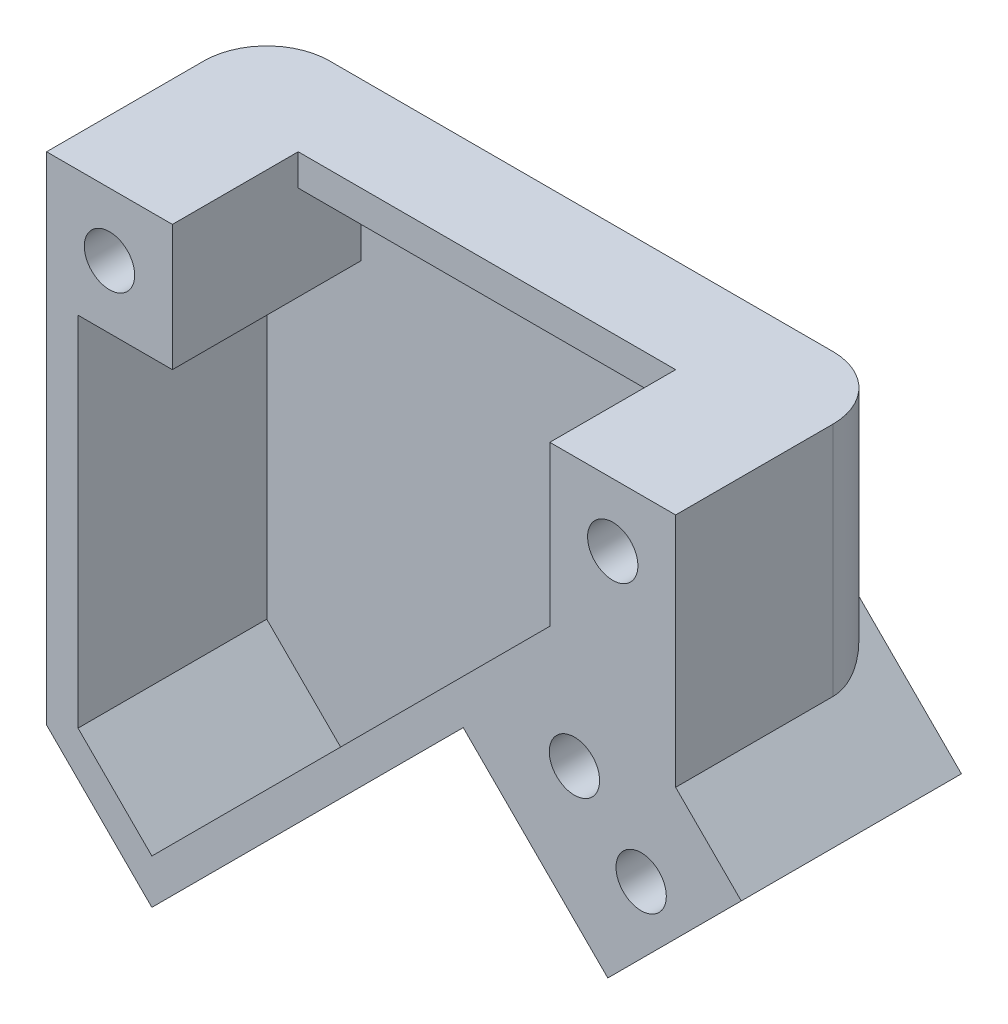
from build123d import *

# Parameters (mm, degrees)
BOSS_EXTRUDE1_DEPTH = 7
BOSS_EXTRUDE2_DEPTH = 1
SKETCH5_R           = 0.799999999
SKETCH5_R_2         = 0.800000001
SCREW_HOLES_DEPTH   = 31.046659105
FILLET1_R           = 2
CUT_EXTRUDE2_START  = 7
SKETCH7_W           = 11.999999998
SKETCH7_H           = 4
CUT_EXTRUDE2_DEPTH  = 4


with BuildPart() as part:
    # Sketch1 → Boss-Extrude1 (new body)
    with BuildSketch(Plane.XY):
        Polygon((0, 0), (19.999999998, 0), (19.999999998, -7.5), (22.085746954, -9.585746956), (17.843106269, -13.828387641), (13.246912191, -9.232193563), (3.347417254, -19.1316885), (0, -15.784271246), align=None)
        Polygon((4, -1), (4, -4), (1, -4), (1, -15.370057685), (3.347417253, -17.717474938), (15.999999998, -5.064892192), (15.999999998, -1), align=None, mode=Mode.SUBTRACT)
    extrude(amount=BOSS_EXTRUDE1_DEPTH)

    # Sketch6 → Boss-Extrude2 (add)
    with BuildSketch(Plane.XY):
        Polygon((0, 0), (19.999999998, 0), (19.999999998, -7.5), (22.085746954, -9.585746956), (17.843106269, -13.828387641), (13.246912191, -9.232193563), (3.347417254, -19.1316885), (0, -15.784271246), align=None)
    extrude(amount=BOSS_EXTRUDE2_DEPTH)

    # Sketch5 → Screw Holes (cut, through all)
    with BuildSketch(Plane.XY):
        with Locations((18.90376644, -10.646407127)):
            Circle(SKETCH5_R)
        with Locations((16.782446096, -8.525086783)):
            Circle(SKETCH5_R)
        with Locations((1.999999999, -2)):
            Circle(SKETCH5_R_2)
        with Locations((17.999999999, -2)):
            Circle(SKETCH5_R_2)
    extrude(amount=SCREW_HOLES_DEPTH, mode=Mode.SUBTRACT)

    # Fillet1
    # the kernel refuses this fillet: 2 mm, written as the material it takes off along each edge
    with BuildSketch(Plane(origin=(19.999999998, 5, 0), x_dir=(-1, 0, 0), z_dir=(0, -1, 0))) as fillet1_piece_1_section:
        with BuildLine():
            CenterArc((FILLET1_R, -FILLET1_R), FILLET1_R, 90, 90)
            Line((0, -FILLET1_R), (0, 0))
            Line((0, 0), (FILLET1_R, 0))
        make_face()
    fillet1_piece_1 = extrude(amount=17.5, mode=Mode.PRIVATE)
    fillet1_piece_1 = split(fillet1_piece_1, bisect_by=Plane(origin=(16.546980954, -4.046980955, 0.4619066), z_dir=(0.7071067811865476, 0.7071067811865476, 0)), keep=Keep.TOP, mode=Mode.PRIVATE)
    add(fillet1_piece_1, mode=Mode.SUBTRACT)
    with BuildSketch(Plane(origin=(6.88295116, -22.667222406, 0), x_dir=(0.7071067811865475, 0.7071067811865477, 0), z_dir=(-0.7071067811865477, 0.7071067811865475, 0))) as fillet1_piece_2:
        with BuildLine():
            CenterArc((FILLET1_R, -FILLET1_R), FILLET1_R, 90, 90)
            Line((0, -FILLET1_R), (0, 0))
            Line((0, 0), (FILLET1_R, 0))
        make_face()
    extrude(amount=14.73396288, mode=Mode.SUBTRACT)
    with BuildSketch(Plane(origin=(0, -20.784271246, 0), x_dir=(1, 0, 0), z_dir=(0, 1, 0))) as fillet1_piece_3:
        with BuildLine():
            CenterArc((FILLET1_R, -FILLET1_R), FILLET1_R, 90, 90)
            Line((0, -FILLET1_R), (0, 0))
            Line((0, 0), (FILLET1_R, 0))
        make_face()
    extrude(amount=25.784271246, mode=Mode.SUBTRACT)

    # Sketch7 → Cut-Extrude2 (cut)
    with BuildSketch(Plane.XY.offset(CUT_EXTRUDE2_START)):
        with Locations((9.999999999, -2)):
            Rectangle(SKETCH7_W, SKETCH7_H)
    extrude(amount=-CUT_EXTRUDE2_DEPTH, mode=Mode.SUBTRACT)


solid = part.part
